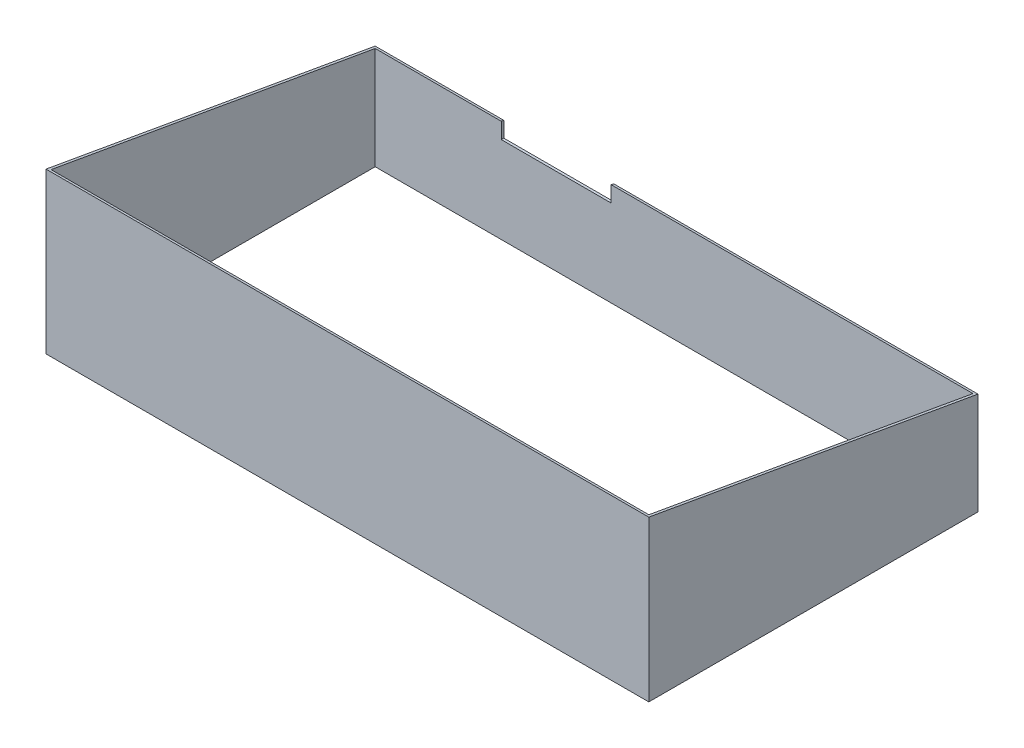
from build123d import *

# Parameters (mm, degrees)
BOSS_EXTRUDE1_DEPTH = 1518.68
SHELL1_T            = -6.35
CUT_EXTRUDE2_REACH  = 1775.764
SKETCH3_W           = 277
SKETCH3_H           = 50


with BuildPart() as part:
    # Sketch1 → Boss-Extrude1 (new body)
    with BuildSketch(Plane(origin=(0, 0, 0), x_dir=(0, 0, -1), z_dir=(1, 0, 0))):
        Polygon((0, 403.229130413), (0, 0), (829.306608812, 0), (829.306608812, 257), align=None)
    extrude(amount=BOSS_EXTRUDE1_DEPTH)

    # Shell1
    shell1_openings = [part.faces().sort_by_distance(p)[0] for p in [
        (759.34, 0, -414.653304406),
        (759.34, 330.114565207, -414.653304406),
    ]]
    offset(amount=SHELL1_T, openings=shell1_openings, kind=Kind.INTERSECTION)

    # Sketch3 → Cut-Extrude2 (cut, up to next)
    with BuildSketch(Plane.XY.offset(-822.956608812), mode=Mode.PRIVATE) as cut_extrude2_sk1:
        with Locations((462.5, 243.119676327)):
            Rectangle(SKETCH3_W, SKETCH3_H)
    cut_extrude2_tool1 = extrude(cut_extrude2_sk1.sketch, amount=-CUT_EXTRUDE2_REACH, mode=Mode.PRIVATE) & part.part
    add(cut_extrude2_tool1.solids().sort_by_distance((462.5, 243.119676, -822.956609))[0], mode=Mode.SUBTRACT)


solid = part.part
